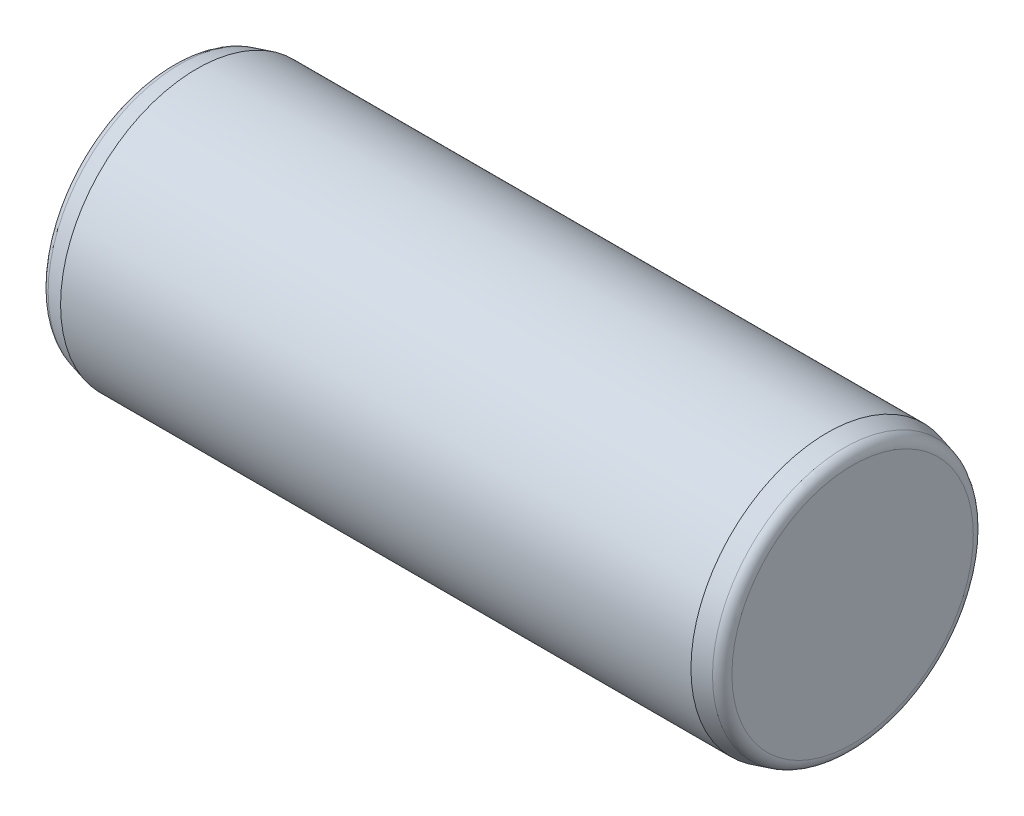
from build123d import *

# Parameters (mm, degrees)
FILLET1_R = 0.5


with BuildPart() as part:
    # Sketch1 → Revolve1 (revolve)
    with BuildSketch(Plane.XY):
        Polygon((0, 0), (0, 5.7), (1.119615242, 6), (28.880384758, 6), (30, 5.7), (30, 0), align=None)
    revolve(axis=Axis((0, 0, 0), (1, 0, 0)))

    # Fillet1
    fillet1_edges = [part.edges().sort_by_distance(p)[0] for p in [
        (0, -5.7, 0),
        (30, -5.7, 0),
    ]]
    fillet(fillet1_edges, radius=FILLET1_R)


solid = part.part
